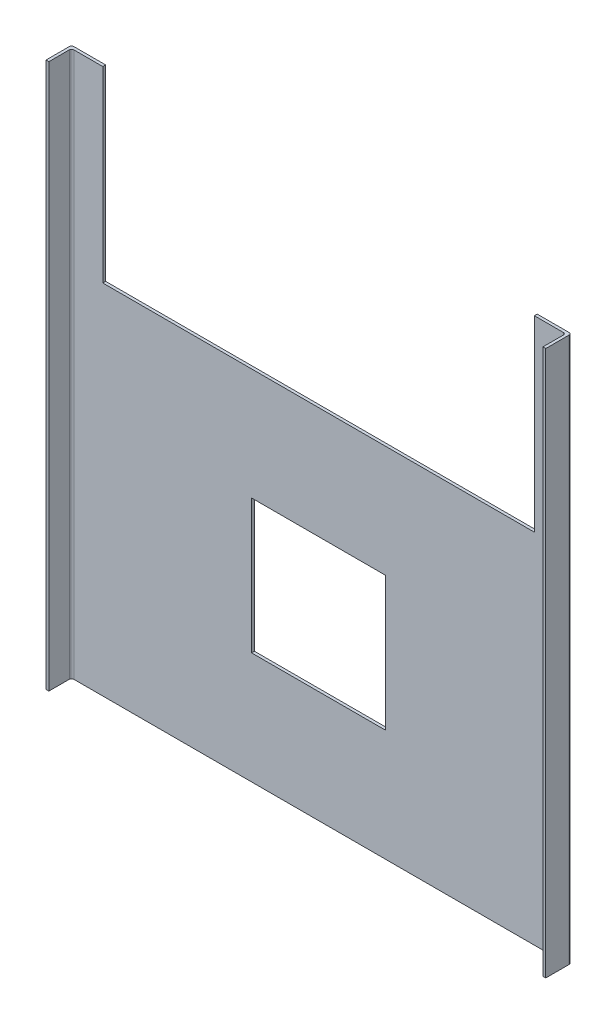
from build123d import *

# Parameters (mm, degrees)
BOSS_EXTRUDE1_DEPTH = 6.35
SKETCH2_W           = 6.35
SKETCH2_H           = 1219.2
BOSS_EXTRUDE2_DEPTH = 50.8
FILLET1_R           = 5
SKETCH3_W           = 300
SKETCH3_H           = 300
CUT_EXTRUDE1_DEPTH  = 1655.915261426


with BuildPart() as part:
    # Sketch1 → Boss-Extrude1 (new body)
    with BuildSketch(Plane.XY):
        Polygon((1041.4, 1219.2), (1117.6, 1219.2), (1117.6, 0), (0, 0), (0, 1219.2), (76.2, 1219.2), (76.2, 800), (1041.4, 800), align=None)
    extrude(amount=BOSS_EXTRUDE1_DEPTH)

    # Sketch2 → Boss-Extrude2 (add)
    with BuildSketch(Plane.XY.offset(6.35)):
        with Locations((3.175, 609.6)):
            Rectangle(SKETCH2_W, SKETCH2_H)
        with Locations((1114.425, 609.6)):
            Rectangle(SKETCH2_W, SKETCH2_H)
    extrude(amount=BOSS_EXTRUDE2_DEPTH)

    # Fillet1
    fillet1_edges = [part.edges().sort_by_distance(p)[0] for p in [
        (1117.6, 609.6, 0),
        (0, 609.6, 0),
        (1111.25, 609.6, 6.35),
        (6.35, 609.6, 6.35),
    ]]
    fillet(fillet1_edges, radius=FILLET1_R)

    # Sketch3 → Cut-Extrude1 (cut, through all)
    with BuildSketch(Plane(origin=(0, 0, 0), x_dir=(-1, 0, 0), z_dir=(0, 0, -1))):
        with Locations((-558.8, 400)):
            Rectangle(SKETCH3_W, SKETCH3_H)
    extrude(amount=-CUT_EXTRUDE1_DEPTH, mode=Mode.SUBTRACT)


solid = part.part
